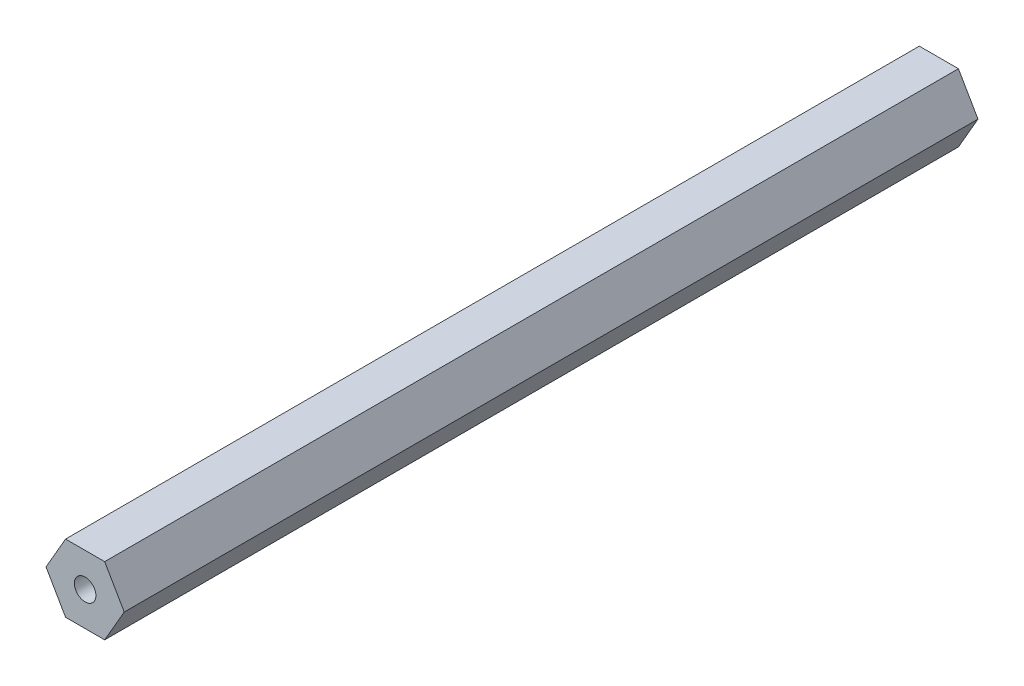
from build123d import *

# Parameters (mm, degrees)
BOSS_EXTRUDE1_DEPTH        = 160.02
F_10_32_TAPPED_HOLE1_D     = 4.0386
F_10_32_TAPPED_HOLE1_DEPTH = 76.2
F_10_32_TAPPED_HOLE1_TIP   = 1.213317848


with BuildPart() as part:
    # Sketch1 → Boss-Extrude1 (new body)
    with BuildSketch(Plane.XY):
        Polygon((7.332348419, 0), (3.666174209, 6.35), (-3.666174209, 6.35), (-7.332348419, 0), (-3.666174209, -6.35), (3.666174209, -6.35), align=None)
    extrude(amount=BOSS_EXTRUDE1_DEPTH)

    # #10-32 Tapped Hole1
    with Locations(Plane.XY.offset(160.02)):
        with Locations((0, 0)):
            Hole(F_10_32_TAPPED_HOLE1_D / 2, depth=F_10_32_TAPPED_HOLE1_DEPTH)
            with Locations((0, 0, -(F_10_32_TAPPED_HOLE1_DEPTH + F_10_32_TAPPED_HOLE1_TIP / 2))):  # 118° drill point
                Cone(0, F_10_32_TAPPED_HOLE1_D / 2, F_10_32_TAPPED_HOLE1_TIP, mode=Mode.SUBTRACT)


solid = part.part
